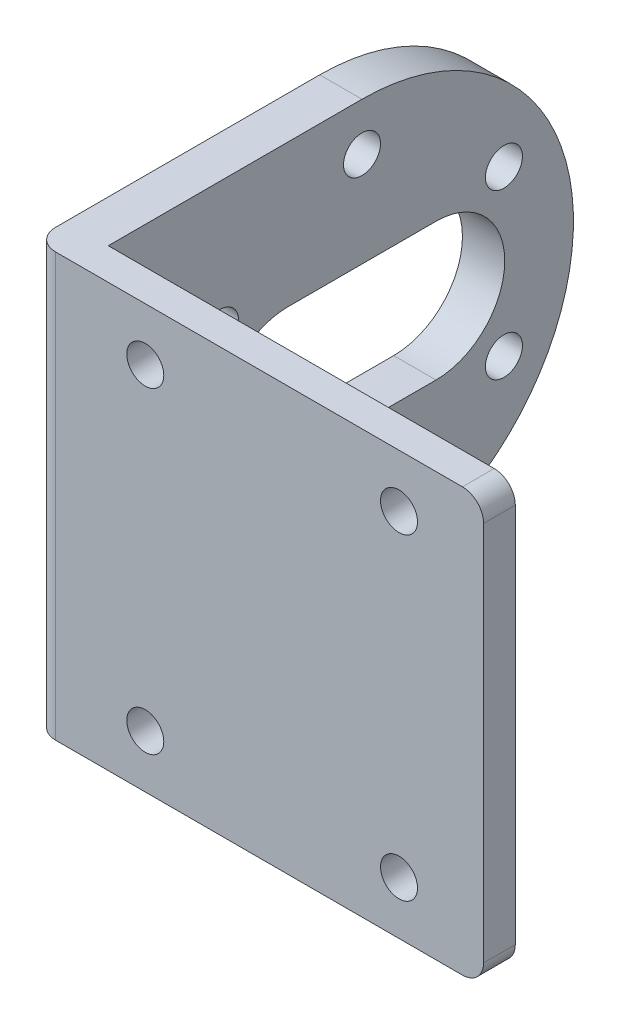
from build123d import *

# Parameters (mm, degrees)
BOSS_EXTRUDE1_DEPTH      = 40
BOSS_EXTRUDE2_DEPTH      = 1
BOSS_EXTRUDE2_DEPTH_BACK = 3
CUT_EXTRUDE1_DEPTH       = 73.740978822
SKETCH5_R                = 1.75
CUT_EXTRUDE2_DEPTH       = 73.740978822
FILLET1_R                = 2
CUT_EXTRUDE3_REACH       = 76.935
SKETCH6_R                = 1.75


# Read off the part's stored shape, not the designer's step: moBlkMgr[Ga_GB37]
with BuildPart() as part:
    # Sketch1 → Boss-Extrude1 (new body)
    with BuildSketch(Plane(origin=(0, 0, 0), x_dir=(1, 0, 0), z_dir=(0, 1, 0))):
        Polygon((0, 0), (0, 27), (3, 27), (3, 3), (42.5, 3), (42.5, 0), align=None)
    extrude(amount=BOSS_EXTRUDE1_DEPTH)

    # Sketch2 → Boss-Extrude2 (add, two sides: drawn at the far end of the back side and taken through both)
    with BuildSketch(Plane(origin=(3, 0, 0), x_dir=(0, 0, -1), z_dir=(1, 0, 0)).offset(-BOSS_EXTRUDE2_DEPTH_BACK)):
        with BuildLine():
            Line((3, 0), (27, 0))
            ThreePointArc((27, 0), (47, 20), (27, 40))
            Line((27, 40), (3, 40))
            Line((3, 40), (3, 0))
        make_face()
    extrude(amount=BOSS_EXTRUDE2_DEPTH + BOSS_EXTRUDE2_DEPTH_BACK)

    # Sketch3 → Cut-Extrude1 (cut, through all)
    with BuildSketch(Plane(origin=(4, 0, 0), x_dir=(0, 0, -1), z_dir=(1, 0, 0))):
        with BuildLine():
            Line((20, 26.5), (34, 26.5))
            ThreePointArc((34, 26.5), (40.5, 20), (34, 13.5))
            Line((34, 13.5), (20, 13.5))
            ThreePointArc((20, 13.5), (13.5, 20), (20, 26.5))
        make_face()
    extrude(amount=-CUT_EXTRUDE1_DEPTH, mode=Mode.SUBTRACT)

    # Sketch5 → Cut-Extrude2 (cut, through all)
    with BuildSketch(Plane(origin=(4, 0, 0), x_dir=(0, 0, -1), z_dir=(1, 0, 0))):
        with Locations((27, 4.5)):
            Circle(SKETCH5_R)
        with Locations((13.576606241, 12.25)):
            Circle(SKETCH5_R)
        with Locations((13.576606241, 27.75)):
            Circle(SKETCH5_R)
        with Locations((27, 35.5)):
            Circle(SKETCH5_R)
        with Locations((40.423393759, 27.75)):
            Circle(SKETCH5_R)
        with Locations((40.423393759, 12.25)):
            Circle(SKETCH5_R)
    extrude(amount=-CUT_EXTRUDE2_DEPTH, mode=Mode.SUBTRACT)

    # Fillet1
    fillet1_edges = [part.edges().sort_by_distance(p)[0] for p in [
        (0, 20, 0),
        (42.5, 0, -1.5),
        (42.5, 40, -1.5),
    ]]
    fillet(fillet1_edges, radius=FILLET1_R)

    # Sketch6 → Cut-Extrude3 (cut, up to next)
    with BuildSketch(Plane.XY, mode=Mode.PRIVATE) as cut_extrude3_sk1:
        with Locations((34.5, 5)):
            Circle(SKETCH6_R)
    cut_extrude3_tool1 = extrude(cut_extrude3_sk1.sketch, amount=-CUT_EXTRUDE3_REACH, mode=Mode.PRIVATE) & part.part
    # Sketch6 → Cut-Extrude3 (cut, up to next)
    with BuildSketch(Plane.XY, mode=Mode.PRIVATE) as cut_extrude3_sk2:
        with Locations((34.5, 35)):
            Circle(SKETCH6_R)
    cut_extrude3_tool2 = extrude(cut_extrude3_sk2.sketch, amount=-CUT_EXTRUDE3_REACH, mode=Mode.PRIVATE) & part.part
    # Sketch6 → Cut-Extrude3 (cut, up to next)
    with BuildSketch(Plane.XY, mode=Mode.PRIVATE) as cut_extrude3_sk3:
        with Locations((10.5, 35)):
            Circle(SKETCH6_R)
    cut_extrude3_tool3 = extrude(cut_extrude3_sk3.sketch, amount=-CUT_EXTRUDE3_REACH, mode=Mode.PRIVATE) & part.part
    # Sketch6 → Cut-Extrude3 (cut, up to next)
    with BuildSketch(Plane.XY, mode=Mode.PRIVATE) as cut_extrude3_sk4:
        with Locations((10.5, 5)):
            Circle(SKETCH6_R)
    cut_extrude3_tool4 = extrude(cut_extrude3_sk4.sketch, amount=-CUT_EXTRUDE3_REACH, mode=Mode.PRIVATE) & part.part
    add(cut_extrude3_tool1.solids().sort_by_distance((34.5, 5, 0))[0], mode=Mode.SUBTRACT)
    add(cut_extrude3_tool2.solids().sort_by_distance((34.5, 35, 0))[0], mode=Mode.SUBTRACT)
    add(cut_extrude3_tool3.solids().sort_by_distance((10.5, 35, 0))[0], mode=Mode.SUBTRACT)
    add(cut_extrude3_tool4.solids().sort_by_distance((10.5, 5, 0))[0], mode=Mode.SUBTRACT)


solid = part.part
